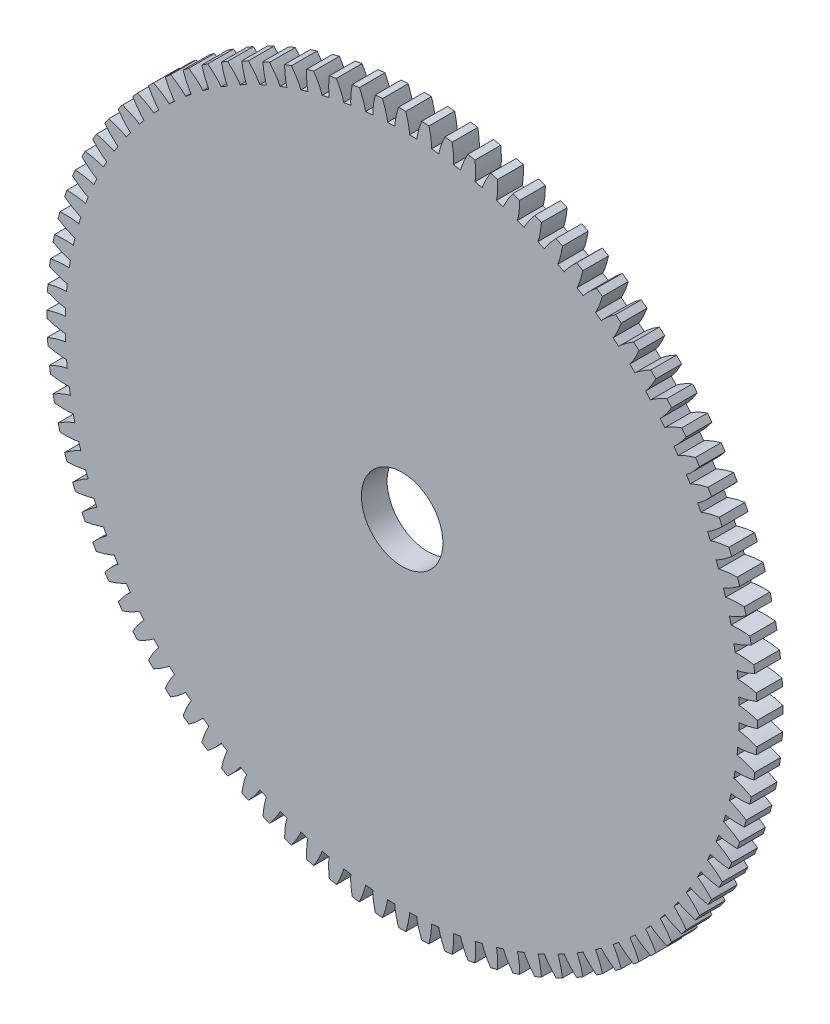
from build123d import *

# Parameters (mm, degrees)
SKETCH1_R               = 41.486666667
BOSS_EXTRUDE1_DEPTH     = 3
CUT_EXTRUDE2_DEPTH      = 4
CIRPATTERN1_COUNT       = 96
CUT_EXTRUDE4_DEPTH      = 5
CUT_EXTRUDE4_DEPTH_BACK = 5
SKETCH3_R               = 4.7625


with BuildPart() as part:
    # Sketch1 → Boss-Extrude1 (new body)
    with BuildSketch(Plane.XY):
        Circle(SKETCH1_R)
    extrude(amount=BOSS_EXTRUDE1_DEPTH)

    # Sketch2 → Cut-Extrude2 (cut, symmetric)
    with BuildSketch(Plane.XY):
        with BuildLine():
            add(Edge.make_bspline(
                [(39.336078935, 0.861885347), (39.345201333, 0.862020681), (39.362459718, 0.861902685), (39.390645333, 0.861305704), (39.429844436, 0.859746028), (39.476363786, 0.857221258), (39.531241939, 0.85337642), (39.591643963, 0.8482375), (39.657469214, 0.841658563), (39.723244691, 0.834219919), (39.788964098, 0.825982971), (39.854529767, 0.817040209), (39.934075026, 0.805333681), (40.029634133, 0.790080584), (40.141606423, 0.770473386), (40.268943363, 0.746132176), (40.399123086, 0.719062736), (40.527559176, 0.690564963), (40.657749914, 0.659618237), (40.784018422, 0.628149679), (40.915650178, 0.593240403), (41.037390606, 0.55988902), (41.174352905, 0.520045747), (41.285044182, 0.487170587), (41.399890052, 0.45113191), (41.455862, 0.433284233), (41.484499599, 0.424033174)],
                knots=[0, 0, 0, 0, 0, 0.015083688, 0.02853182, 0.04661014, 0.06485485, 0.092110526, 0.119476176, 0.146842496, 0.174208854, 0.201574956, 0.228941013, 0.256307345, 0.307035032, 0.361767352, 0.416499661, 0.471231937, 0.525964282, 0.580696616, 0.635428982, 0.690161387, 0.744893688, 0.799626082, 0.854358407, 0.909090914, 0.909090914, 0.909090914, 0.909090914, 0.909090914], degree=4))
            Line((41.484499599, 0.424033174), (59.996865883, 0.613257042))
            add(Edge.make_bspline(
                [(59.996865883, 0.613257042), (59.996592062, 0.640045874), (59.996012817, 0.692221525), (59.994462642, 0.823662983), (59.992883334, 0.924222134), (59.990570756, 1.069613826), (59.988257163, 1.188037858), (59.985503462, 1.322730006), (59.982571572, 1.447602339), (59.979308978, 1.578346223), (59.975798035, 1.705633629), (59.97200551, 1.834816416), (59.967924092, 1.963146568), (59.963603578, 2.091468893), (59.958939024, 2.220623133), (59.954117455, 2.347867633), (59.948822005, 2.478544969), (59.943580576, 2.603341696), (59.937519093, 2.737925557), (59.932082431, 2.856247351), (59.924880986, 3.001478998), (59.919880029, 3.101926136), (59.912830202, 3.233187554), (59.909995755, 3.285289377), (59.908516917, 3.312038762)],
                knots=[0.083333333, 0.083333333, 0.083333333, 0.083333333, 0.083333333, 0.123015873, 0.162698413, 0.202380952, 0.242063492, 0.281746032, 0.321428571, 0.361111111, 0.400793651, 0.44047619, 0.48015873, 0.51984127, 0.55952381, 0.599206349, 0.638888889, 0.678571429, 0.718253968, 0.757936508, 0.797619048, 0.837301587, 0.876984127, 0.916666667, 0.916666667, 0.916666667, 0.916666667, 0.916666667], degree=4))
            Line((59.908516917, 3.312038762), (41.423411197, 2.290090801))
            add(Edge.make_bspline(
                [(39.308227369, 1.71266267), (39.317339086, 1.713124259), (39.334552803, 1.714370754), (39.362639025, 1.716809885), (39.401652192, 1.720929966), (39.447906814, 1.72649184), (39.502416003, 1.733917649), (39.562352601, 1.742996048), (39.627606632, 1.753866077), (39.692754768, 1.765590716), (39.757794742, 1.778108283), (39.822635146, 1.791320097), (39.901244449, 1.808204069), (39.995601356, 1.829674373), (40.106051532, 1.856562929), (40.231523843, 1.889180257), (40.359654416, 1.9247059), (40.48595167, 1.96154278), (40.613839647, 2.000938128), (40.737779663, 2.040597665), (40.866846409, 2.084041326), (40.986144897, 2.125283507), (41.120208074, 2.173999235), (41.228512214, 2.214043563), (41.340755148, 2.257516357), (41.395439962, 2.278986562), (41.423411197, 2.290090801)],
                knots=[0, 0, 0, 0, 0, 0.015083688, 0.02853182, 0.04661014, 0.06485485, 0.092110526, 0.119476176, 0.146842496, 0.174208854, 0.201574956, 0.228941013, 0.256307345, 0.307035032, 0.361767352, 0.416499661, 0.471231937, 0.525964282, 0.580696616, 0.635428982, 0.690161387, 0.744893688, 0.799626082, 0.854358407, 0.909090914, 0.909090914, 0.909090914, 0.909090914, 0.909090914], degree=4))
            Line((39.308227369, 1.71266267), (39.336078935, 0.861885347))
        make_face()
    cut_extrude2 = extrude(amount=CUT_EXTRUDE2_DEPTH, both=True, mode=Mode.SUBTRACT)

    # CirPattern1: Cut-Extrude2 ×96 about axis
    cirpattern1_axis = Axis((0, 0, -0.15), (0, 0, 1))
    for i in range(1, CIRPATTERN1_COUNT):
        add(cut_extrude2.rotate(cirpattern1_axis, i * 360 / CIRPATTERN1_COUNT), mode=Mode.SUBTRACT)

    # Sketch3 → Cut-Extrude4 (cut, two sides: drawn at the far end of the back side and taken through both)
    with BuildSketch(Plane.XY.offset(-CUT_EXTRUDE4_DEPTH_BACK)):
        Circle(SKETCH3_R)
    extrude(amount=CUT_EXTRUDE4_DEPTH + CUT_EXTRUDE4_DEPTH_BACK, mode=Mode.SUBTRACT)


solid = part.part
